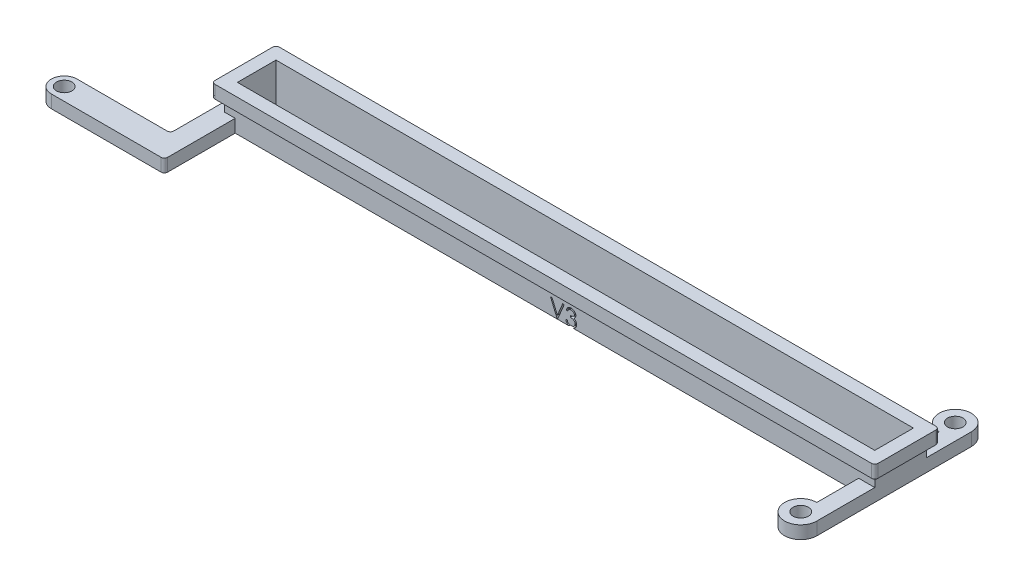
from build123d import *

# Parameters (mm, degrees)
SKETCH1_W           = 101
SKETCH1_H           = 8
SKETCH1_W_2         = 99
SKETCH1_H_2         = 6
BOSS_EXTRUDE1_DEPTH = 10
SKETCH2_R           = 1.2
BOSS_EXTRUDE2_DEPTH = 2
SKETCH3_W           = 103
SKETCH3_H           = 10
SKETCH3_W_2         = 101
SKETCH3_H_2         = 8
BOSS_EXTRUDE3_DEPTH = 6
FILLET4_R           = 1
FILLET5_R           = 1
FILLET6_R           = 1
FILLET7_R           = 1
FILLET8_R           = 0.5
FILLET9_R           = 0.5
CUT_EXTRUDE1_DEPTH  = 4
CUT_EXTRUDE2_DEPTH  = 0.5


# Some blends are built 0.0001 mm under size
with BuildPart() as part:
    # Sketch1 → Boss-Extrude1 (new body)
    with BuildSketch(Plane(origin=(0, 0, 0), x_dir=(1, 0, 0), z_dir=(0, 1, 0))):
        Rectangle(SKETCH1_W, SKETCH1_H)
        Rectangle(SKETCH1_W_2, SKETCH1_H_2, mode=Mode.SUBTRACT)
    extrude(amount=BOSS_EXTRUDE1_DEPTH)

    # Sketch2 → Boss-Extrude2 (add)
    # profile 1 of 3: a face of its own
    with BuildSketch(Plane.XZ):
        with BuildLine():
            Line((48, 4), (50.5, 4))
            Line((50.5, 4), (50.5, 13))
            ThreePointArc((50.5, 13), (46.232233047, 14.767766953), (48, 10.5))
            Line((48, 10.5), (48, 4))
        make_face()
        with Locations(Location((48, 13, 0), (0, 0, 270))):
            Circle(SKETCH2_R, mode=Mode.SUBTRACT)
    # profile 2 of 3: a face of its own
    with BuildSketch(Plane.XZ):
        with BuildLine():
            Line((48, -4), (50.5, -4))
            Line((50.5, -4), (50.5, -11))
            ThreePointArc((50.5, -11), (46.232233047, -12.767766953), (48, -8.5))
            Line((48, -8.5), (48, -4))
        make_face()
        with Locations(Location((48, -11, 0), (0, 0, 270))):
            Circle(SKETCH2_R, mode=Mode.SUBTRACT)
    # profile 3 of 3: a face of its own
    with BuildSketch(Plane.XZ):
        with BuildLine():
            Line((-66.4, 15), (-48.835058433, 15))
            Line((-48.835058433, 15), (-48.835058433, 4))
            Line((-48.835058433, 4), (-50.5, 4))
            Line((-50.5, 4), (-50.5, -4))
            Line((-50.5, -4), (-51.901659191, -4))
            Line((-51.901659191, -4), (-51.901659191, 11))
            Line((-51.901659191, 11), (-66.4, 11))
            ThreePointArc((-66.4, 11), (-68.4, 13), (-66.4, 15))
        make_face()
        with Locations(Location((-66.4, 13, 0), (0, 0, 270))):
            Circle(SKETCH2_R, mode=Mode.SUBTRACT)
    extrude(amount=-BOSS_EXTRUDE2_DEPTH)

    # Sketch3 → Boss-Extrude3 (add)
    with BuildSketch(Plane(origin=(0, 10, 0), x_dir=(1, 0, 0), z_dir=(0, 1, 0))):
        Rectangle(SKETCH3_W, SKETCH3_H)
        Rectangle(SKETCH3_W_2, SKETCH3_H_2, mode=Mode.SUBTRACT)
    extrude(amount=-BOSS_EXTRUDE3_DEPTH)

    # Fillet4
    fillet4_edges = [part.edges().sort_by_distance(p)[0] for p in [
        (0, 4, -4),
    ]]
    fillet(fillet4_edges, radius=FILLET4_R - 0.0001)  # a hair under: the kernel refuses the full size

    # Fillet5
    fillet5_edges = [part.edges().sort_by_distance(p)[0] for p in [
        (0, 4, 4),
    ]]
    fillet(fillet5_edges, radius=FILLET5_R - 0.0001)  # a hair under: the kernel refuses the full size

    # Fillet6
    fillet6_edges = [part.edges().sort_by_distance(p)[0] for p in [
        (50.5, 4, 0),
    ]]
    fillet(fillet6_edges, radius=FILLET6_R - 0.0001)  # a hair under: the kernel refuses the full size

    # Fillet7
    fillet7_edges = [part.edges().sort_by_distance(p)[0] for p in [
        (-50.5, 4, 0),
    ]]
    fillet(fillet7_edges, radius=FILLET7_R - 0.0001)  # a hair under: the kernel refuses the full size

    # Fillet8
    fillet8_edges = [part.edges().sort_by_distance(p)[0] for p in [
        (-51.901659191, 1, 11),
        (-48.835058433, 1, 15),
    ]]
    fillet(fillet8_edges, radius=FILLET8_R)

    # Fillet9
    # the kernel refuses this fillet: 0.5 mm, written as the material it takes off along each edge
    with BuildSketch(Plane(origin=(51.5, 11.25, -5), x_dir=(-1, 0, 0), z_dir=(0, -1, 0))) as fillet9_piece_1:
        with BuildLine():
            CenterArc((FILLET9_R, -FILLET9_R), FILLET9_R, 90, 90)
            Line((0, -FILLET9_R), (0, 0))
            Line((0, 0), (FILLET9_R, 0))
        make_face()
    extrude(amount=8.5, mode=Mode.SUBTRACT)
    with BuildSketch(Plane(origin=(51.5, 11.25, 5), x_dir=(-1, 0, 0), z_dir=(0, -1, 0)), Plane(origin=(-51.5, 11.25, 5), x_dir=(0, 0, -1), z_dir=(0, -1, 0)), Plane(origin=(-51.5, 11.25, -5), x_dir=(1, 0, 0), z_dir=(0, -1, 0))) as fillet9_piece_2:
        with BuildLine():
            CenterArc((FILLET9_R, FILLET9_R), FILLET9_R, 180, 90)
            Line((0, FILLET9_R), (0, 0))
            Line((0, 0), (FILLET9_R, 0))
        make_face()
    extrude(amount=8.5, mode=Mode.SUBTRACT)

    # Sketch4 → Cut-Extrude1 (cut)
    with BuildSketch(Plane(origin=(0, 10, 0), x_dir=(1, 0, 0), z_dir=(0, 1, 0))):
        with BuildLine():
            Line((51.5, -4.5), (51.5, 4.5))
            ThreePointArc((51.5, 4.5), (51.353553391, 4.853553391), (51, 5))
            Line((51, 5), (-51, 5))
            ThreePointArc((-51, 5), (-51.353553391, 4.853553391), (-51.5, 4.5))
            Line((-51.5, 4.5), (-51.5, -4.5))
            ThreePointArc((-51.5, -4.5), (-51.353553391, -4.853553391), (-51, -5))
            Line((-51, -5), (51, -5))
            ThreePointArc((51, -5), (51.353553391, -4.853553391), (51.5, -4.5))
        make_face()
    extrude(amount=-CUT_EXTRUDE1_DEPTH, mode=Mode.SUBTRACT)

    # Sketch5 → Cut-Extrude2 (cut)
    with BuildSketch(Plane.XY.offset(4)):
        Polygon((0.128205128, 2.5), (0.368589744, 2.5), (1.201923077, 0.529847756), (2.03525641, 2.5), (2.275641026, 2.5), (1.217948718, 0), (1.185897436, 0), align=None)
        with BuildLine():
            Line((2.820512821, 1.923076923), (2.596153846, 1.923076923))
            add(Edge.make_bspline(
                [(2.596153846, 1.923076923), (2.602232097, 1.948242983), (2.614114579, 1.997440572), (2.63889856, 2.067731473), (2.665898028, 2.134248274), (2.698318817, 2.195745469), (2.733682213, 2.253458971), (2.774198443, 2.306079774), (2.817998245, 2.354946178), (2.866444637, 2.398312776), (2.917250824, 2.437582583), (2.971132695, 2.471064767), (3.027006191, 2.499867733), (3.085258428, 2.52359647), (3.146062837, 2.541471844), (3.208869711, 2.554440991), (3.273843639, 2.562863215), (3.317949061, 2.563685189), (3.340344551, 2.564102564)],
                knots=[0, 0, 0, 0, 1.162005537, 2.271625781, 3.343758855, 4.383309926, 5.390229558, 6.379919256, 7.361854164, 8.333198761, 9.295911338, 10.242430842, 11.177959212, 12.116337295, 13.062827104, 14.020064771, 14.994644689, 16, 16, 16, 16], degree=3))
            add(Edge.make_bspline(
                [(3.340344551, 2.564102564), (3.372975081, 2.5631174), (3.437524375, 2.56116856), (3.532355123, 2.543372534), (3.623802851, 2.515211725), (3.710866599, 2.47630192), (3.791736908, 2.428310982), (3.863691327, 2.371193313), (3.925754549, 2.306050955), (3.977821962, 2.234099123), (4.018589818, 2.157202331), (4.048651514, 2.078059361), (4.066952714, 1.996857953), (4.069324541, 1.942031325), (4.070512821, 1.914563301)],
                knots=[0, 0, 0, 0, 1.083050992, 2.142477498, 3.193116406, 4.255571735, 5.30263384, 6.308962982, 7.297363603, 8.282367274, 9.249857812, 10.179914175, 11.08814088, 12, 12, 12, 12], degree=3))
            add(Edge.make_bspline(
                [(4.070512821, 1.914563301), (4.069681684, 1.888129876), (4.068055279, 1.836403766), (4.054245489, 1.760888411), (4.031005302, 1.689715839), (3.998812614, 1.622586438), (3.957140078, 1.559925838), (3.90665958, 1.501593059), (3.847014822, 1.447329374), (3.80181558, 1.416244037), (3.778545673, 1.400240385)],
                knots=[0, 0, 0, 0, 1.024540389, 2.004866551, 2.965041327, 3.920577974, 4.882998113, 5.874504559, 6.905732034, 8, 8, 8, 8], degree=3))
            add(Edge.make_bspline(
                [(3.778545673, 1.400240385), (3.805139783, 1.387398834), (3.857830408, 1.361956007), (3.929652215, 1.312059037), (3.994850697, 1.25444736), (4.031210496, 1.209488323), (4.049479167, 1.186899038)],
                knots=[0, 0, 0, 0, 1.015518401, 2.012035669, 3.001164323, 4, 4, 4, 4], degree=3))
            add(Edge.make_bspline(
                [(4.049479167, 1.186899038), (4.061508697, 1.170429216), (4.085370766, 1.137759275), (4.114824718, 1.085233257), (4.141545514, 1.03212505), (4.162367099, 0.977011189), (4.17849129, 0.920530465), (4.190017027, 0.862585896), (4.197177128, 0.803130166), (4.198202522, 0.762906966), (4.198717949, 0.742688301)],
                knots=[0, 0, 0, 0, 1.025084078, 2.033381695, 3.024893161, 4.013698104, 4.991890475, 5.976764909, 6.982997093, 8, 8, 8, 8], degree=3))
            add(Edge.make_bspline(
                [(4.198717949, 0.742688301), (4.197436153, 0.707681358), (4.194878595, 0.637832213), (4.172018542, 0.534635984), (4.136580513, 0.433760625), (4.08625413, 0.337278597), (4.024920195, 0.247006896), (3.951950678, 0.166238104), (3.868174672, 0.096810529), (3.774742065, 0.038803224), (3.673515545, -0.007566721), (3.565247265, -0.039750608), (3.451497226, -0.060712037), (3.373492014, -0.0629598), (3.333834135, -0.064102564)],
                knots=[0, 0, 0, 0, 0.955779014, 1.907060117, 2.875433937, 3.871313158, 4.872415639, 5.851225146, 6.836215519, 7.83643374, 8.849228613, 9.86973379, 10.916971861, 12, 12, 12, 12], degree=3))
            add(Edge.make_bspline(
                [(3.333834135, -0.064102564), (3.307106063, -0.063482412), (3.254514131, -0.062262159), (3.177197346, -0.053920301), (3.103396132, -0.038684583), (3.033010705, -0.018182222), (2.965978537, 0.00781188), (2.902504176, 0.040182378), (2.842197109, 0.078262023), (2.785626429, 0.1225003), (2.732798881, 0.171986971), (2.685118364, 0.227600549), (2.64178994, 0.288312981), (2.60397377, 0.354829449), (2.569947375, 0.426290348), (2.541960977, 0.503610704), (2.517328428, 0.586099291), (2.505875954, 0.643583391), (2.5, 0.673076923)],
                knots=[0, 0, 0, 0, 1.048658725, 2.063410685, 3.046034179, 4.001477787, 4.936774919, 5.862367409, 6.792675028, 7.730719943, 8.675894397, 9.627829632, 10.600096036, 11.597688215, 12.626045268, 13.701542398, 14.82072376, 16, 16, 16, 16], degree=3))
            Line((2.5, 0.673076923), (2.724358974, 0.673076923))
            add(Edge.make_bspline(
                [(2.724358974, 0.673076923), (2.730204183, 0.653827628), (2.74157362, 0.616386077), (2.76092669, 0.562500144), (2.782975456, 0.513101535), (2.806628712, 0.467827876), (2.831470459, 0.426233303), (2.859266834, 0.389417682), (2.887959081, 0.355763966), (2.90958719, 0.336803529), (2.920172276, 0.327524038)],
                knots=[0, 0, 0, 0, 1.198163088, 2.33053128, 3.407730985, 4.417276592, 5.372219308, 6.28897303, 7.162600585, 8, 8, 8, 8], degree=3))
            add(Edge.make_bspline(
                [(2.920172276, 0.327524038), (2.93416983, 0.316732371), (2.962121732, 0.295182349), (3.007670469, 0.267681185), (3.055573959, 0.243851882), (3.106870155, 0.225649242), (3.160452134, 0.210236627), (3.217185966, 0.200150542), (3.276571121, 0.19323042), (3.317119524, 0.192619754), (3.337840545, 0.192307692)],
                knots=[0, 0, 0, 0, 0.946170439, 1.889420265, 2.845303464, 3.807233317, 4.801018734, 5.828864929, 6.890507805, 8, 8, 8, 8], degree=3))
            add(Edge.make_bspline(
                [(3.337840545, 0.192307692), (3.361235904, 0.192747625), (3.406983509, 0.193607874), (3.47373698, 0.201519093), (3.537242299, 0.213040817), (3.596794389, 0.230835805), (3.653173323, 0.252822128), (3.705588787, 0.280428131), (3.754728863, 0.312817218), (3.799964153, 0.349630903), (3.840639515, 0.389931971), (3.876453453, 0.432084165), (3.90689964, 0.475909757), (3.931459339, 0.521651272), (3.950852589, 0.569119293), (3.964054875, 0.618447028), (3.973234529, 0.66923079), (3.973982109, 0.703751482), (3.974358974, 0.721153846)],
                knots=[0, 0, 0, 0, 1.217147791, 2.380027433, 3.494444702, 4.572153297, 5.609568379, 6.639424714, 7.649109417, 8.668170816, 9.669597737, 10.625200337, 11.543417969, 12.441394052, 13.322311151, 14.205496177, 15.095365482, 16, 16, 16, 16], degree=3))
            add(Edge.make_bspline(
                [(3.974358974, 0.721153846), (3.973265902, 0.74444766), (3.971085196, 0.79091938), (3.95443621, 0.859289076), (3.927051307, 0.925162942), (3.888713799, 0.987417078), (3.842045422, 1.04511415), (3.78749906, 1.09659378), (3.724621754, 1.139072417), (3.666750419, 1.168421457), (3.615489593, 1.188447939), (3.571621461, 1.2017872), (3.522509601, 1.213082668), (3.468747924, 1.223591433), (3.40993134, 1.232535254), (3.346123885, 1.239993693), (3.277312626, 1.24596158), (3.229676079, 1.248626648), (3.205128205, 1.25)],
                knots=[0, 0, 0, 0, 1.07054697, 2.135767047, 3.216561865, 4.33974944, 5.486079747, 6.621378074, 7.775625952, 8.963672916, 9.598146892, 10.304877434, 11.070270905, 11.915000392, 12.823868403, 13.805723172, 14.86925407, 16, 16, 16, 16], degree=3))
            Line((3.205128205, 1.25), (3.205128205, 1.506410256))
            add(Edge.make_bspline(
                [(3.205128205, 1.506410256), (3.236057609, 1.506935116), (3.296640714, 1.507963188), (3.385136646, 1.520397481), (3.46976044, 1.537597929), (3.548636685, 1.563944495), (3.620528623, 1.594544707), (3.682899767, 1.630153428), (3.734876301, 1.669735392), (3.776205638, 1.713901542), (3.807297944, 1.761269433), (3.83003137, 1.810638474), (3.843460175, 1.862441375), (3.845252794, 1.897794709), (3.846153846, 1.915564904)],
                knots=[0, 0, 0, 0, 1.321986639, 2.589447074, 3.816329219, 5.01088745, 6.139805852, 7.153945165, 8.075214402, 8.924034688, 9.728124013, 10.488707548, 11.240355623, 12, 12, 12, 12], degree=3))
            add(Edge.make_bspline(
                [(3.846153846, 1.915564904), (3.845857838, 1.928620436), (3.845268945, 1.954593798), (3.837842318, 1.992540276), (3.826682289, 2.029326666), (3.811339625, 2.06479653), (3.790803769, 2.098703869), (3.766228064, 2.131337761), (3.736965135, 2.162511889), (3.703432673, 2.19156926), (3.667424241, 2.219261572), (3.627960116, 2.242771313), (3.586230205, 2.262874929), (3.542188309, 2.279453144), (3.495691502, 2.291924065), (3.446958246, 2.300878237), (3.395895615, 2.306476562), (3.361058664, 2.307282573), (3.343349359, 2.307692308)],
                knots=[0, 0, 0, 0, 0.884392785, 1.759457502, 2.611959086, 3.489218968, 4.37281399, 5.2945488, 6.255912374, 7.266815255, 8.301784654, 9.332968512, 10.37626691, 11.440494194, 12.520033166, 13.637162961, 14.798855837, 16, 16, 16, 16], degree=3))
            add(Edge.make_bspline(
                [(3.343349359, 2.307692308), (3.314883882, 2.306698478), (3.259284184, 2.304757297), (3.179130672, 2.287755144), (3.104616862, 2.260627942), (3.047660672, 2.228247213), (3.00560169, 2.196282618), (2.975546735, 2.168366628), (2.946032084, 2.137343182), (2.918999458, 2.101301485), (2.891660903, 2.06268235), (2.866771931, 2.019522577), (2.842586436, 1.97294801), (2.828013186, 1.940022556), (2.820512821, 1.923076923)],
                knots=[0, 0, 0, 0, 1.472543308, 2.876219568, 4.221790263, 5.565193594, 6.249813518, 6.953379497, 7.687249741, 8.463570142, 9.283606569, 10.136032583, 11.040678096, 12, 12, 12, 12], degree=3))
        make_face()
    extrude(amount=-CUT_EXTRUDE2_DEPTH, mode=Mode.SUBTRACT)


solid = part.part
